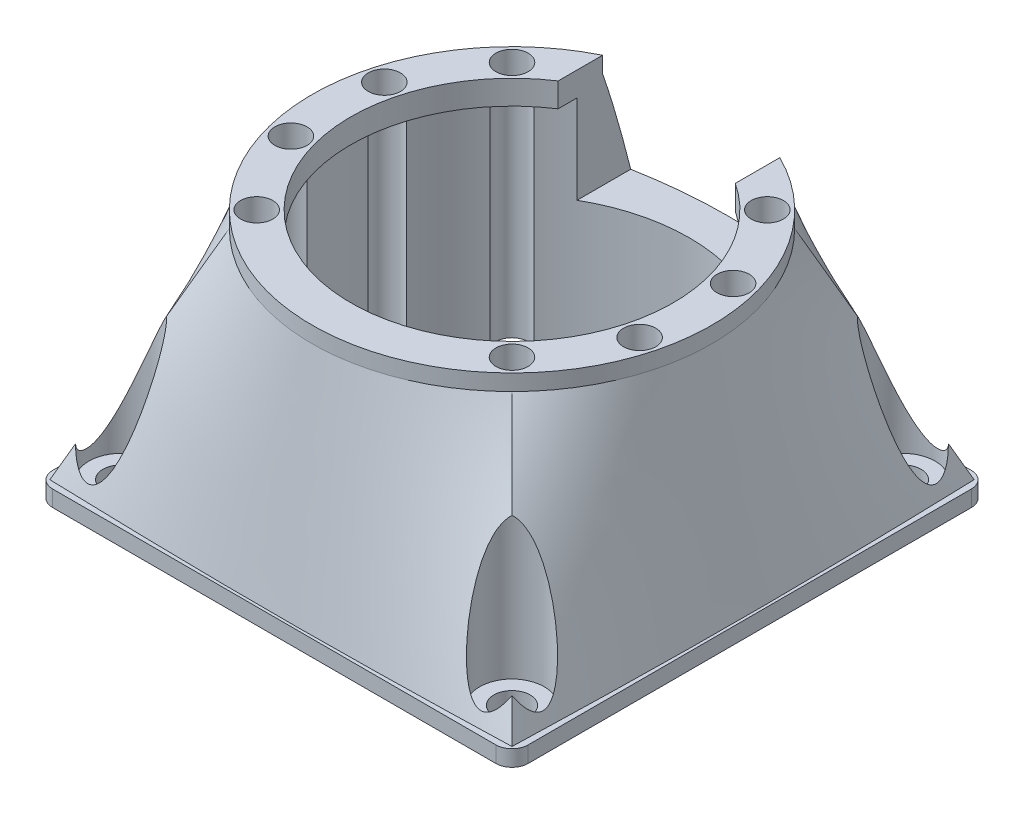
from build123d import *

# Parameters (mm, degrees)
SKETCH5_R               = 12.4
BOSS_EXTRUDE1_DEPTH     = 1
CUT_EXTRUDE1_DEPTH      = 26.987978163
CUT_EXTRUDE1_DEPTH_BACK = 26.987978163
SKETCH6_R               = 10
CUT_EXTRUDE2_DEPTH      = 26.987978163
CUT_EXTRUDE2_DEPTH_BACK = 23.5
SKETCH8_R               = 1
SKETCH1_W               = 29.5
SKETCH1_H               = 29.5
BOSS_EXTRUDE3_DEPTH     = 1
CUT_EXTRUDE4_DEPTH      = 14
CUT_EXTRUDE4_DEPTH_BACK = 8
SKETCH11_R              = 1.125
SKETCH11_R_2            = 11
CUT_EXTRUDE5_DEPTH      = 26.404232104
CUT_EXTRUDE5_DEPTH_BACK = 26.404232104
SKETCH12_R              = 1
SKETCH13_R              = 2
CUT_EXTRUDE6_DEPTH      = 26.404232104
SKETCH15_W              = 11
SKETCH15_H              = 7
CUT_EXTRUDE7_DEPTH      = 26.987978163
FILLET1_R               = 1


with BuildPart() as part:
    # Sketch2 for Loft3 → Loft3 section 0
    with BuildSketch(Plane(origin=(0, 14.5, 0), x_dir=(1, 0, 0), z_dir=(0, 1, 0))):
        with BuildLine():
            # circular arc as an exact rational Bezier (weights 1, cos(half-angle), 1)
            Bezier((8.768124087, -8.768124087), (0, -17.536248173), (-8.768124087, -8.768124087), weights=[1, 0.707106781, 1])
            Bezier((-8.768124087, -8.768124087), (-17.536248173, 0), (-8.768124087, 8.768124087), weights=[1, 0.707106781, 1])
            Bezier((-8.768124087, 8.768124087), (0, 17.536248173), (8.768124087, 8.768124087), weights=[1, 0.707106781, 1])
            Bezier((8.768124087, 8.768124087), (17.536248173, 0), (8.768124087, -8.768124087), weights=[1, 0.707106781, 1])
        make_face()
    # Sketch3 → Loft3 section 1
    with BuildSketch(Plane(origin=(0, 0, 0), x_dir=(1, 0, 0), z_dir=(0, 1, 0))):
        with BuildLine():
            Line((14.75, -14.75), (-14.75, -14.75))
            Line((-14.75, -14.75), (-14.75, 14.75))
            Line((-14.75, 14.75), (14.75, 14.75))
            Line((14.75, 14.75), (14.75, -14.75))
        make_face()
    loft()

    # Sketch5 → Boss-Extrude1 (add)
    with BuildSketch(Plane(origin=(0, 14.5, 0), x_dir=(1, 0, 0), z_dir=(0, 1, 0))):
        Circle(SKETCH5_R)
    extrude(amount=BOSS_EXTRUDE1_DEPTH)

    # Sketch6 → Cut-Extrude1 (cut, two sides: drawn at the far end of the back side and taken through both)
    with BuildSketch(Plane(origin=(0, 15.5, 0), x_dir=(1, 0, 0), z_dir=(0, 1, 0)).offset(-CUT_EXTRUDE1_DEPTH_BACK)):
        Circle(SKETCH6_R)
    extrude(amount=CUT_EXTRUDE1_DEPTH + CUT_EXTRUDE1_DEPTH_BACK, mode=Mode.SUBTRACT)

    # Sketch8 → Cut-Extrude2 (cut, two sides: drawn at the far end of the back side and taken through both)
    with BuildSketch(Plane(origin=(0, 15.5, 0), x_dir=(1, 0, 0), z_dir=(0, 1, 0)).offset(-CUT_EXTRUDE2_DEPTH_BACK)):
        with Locations((-7.919595949, 7.919595949)):
            Circle(SKETCH8_R)
        with Locations((-10.818369254, 2.898773305)):
            Circle(SKETCH8_R)
        with Locations((-10.818369254, -2.898773305)):
            Circle(SKETCH8_R)
        with Locations((-7.919595949, -7.919595949)):
            Circle(SKETCH8_R)
        with Locations((7.919595949, -7.919595949)):
            Circle(SKETCH8_R)
        with Locations((10.818369254, -2.898773305)):
            Circle(SKETCH8_R)
        with Locations((10.818369254, 2.898773305)):
            Circle(SKETCH8_R)
        with Locations((7.919595949, 7.919595949)):
            Circle(SKETCH8_R)
    extrude(amount=CUT_EXTRUDE2_DEPTH + CUT_EXTRUDE2_DEPTH_BACK, mode=Mode.SUBTRACT)

    # Sketch1 → Boss-Extrude3 (add)
    with BuildSketch(Plane(origin=(0, 0, 0), x_dir=(1, 0, 0), z_dir=(0, 1, 0))):
        Rectangle(SKETCH1_W, SKETCH1_H)
    extrude(amount=BOSS_EXTRUDE3_DEPTH)

    # Sketch11 → Cut-Extrude4 (cut, two sides: drawn at the far end of the back side and taken through both)
    with BuildSketch(Plane(origin=(0, 0, 0), x_dir=(1, 0, 0), z_dir=(0, 1, 0)).offset(-CUT_EXTRUDE4_DEPTH_BACK)):
        with Locations((-12.125, 12.125)):
            Circle(SKETCH11_R)
        with Locations((-12.125, -12.125)):
            Circle(SKETCH11_R)
        with Locations((12.125, -12.125)):
            Circle(SKETCH11_R)
        with Locations((12.125, 12.125)):
            Circle(SKETCH11_R)
        Circle(SKETCH11_R_2)
    extrude(amount=CUT_EXTRUDE4_DEPTH + CUT_EXTRUDE4_DEPTH_BACK, mode=Mode.SUBTRACT)

    # Sketch12 → Cut-Extrude5 (cut, two sides: drawn at the far end of the back side and taken through both)
    with BuildSketch(Plane(origin=(0, 1, 0), x_dir=(1, 0, 0), z_dir=(0, 1, 0)).offset(-CUT_EXTRUDE5_DEPTH_BACK)):
        with Locations((-7.919595949, 7.919595949)):
            Circle(SKETCH12_R)
        with Locations((-10.818369254, 2.898773305)):
            Circle(SKETCH12_R)
        with Locations((-10.818369254, -2.898773305)):
            Circle(SKETCH12_R)
        with Locations((-7.919595949, -7.919595949)):
            Circle(SKETCH12_R)
        with Locations((7.919595949, -7.919595949)):
            Circle(SKETCH12_R)
        with Locations((10.818369254, -2.898773305)):
            Circle(SKETCH12_R)
        with Locations((10.818369254, 2.898773305)):
            Circle(SKETCH12_R)
        with Locations((7.919595949, 7.919595949)):
            Circle(SKETCH12_R)
    extrude(amount=CUT_EXTRUDE5_DEPTH + CUT_EXTRUDE5_DEPTH_BACK, mode=Mode.SUBTRACT)

    # Sketch13 → Cut-Extrude6 (cut, through all)
    with BuildSketch(Plane(origin=(0, 1, 0), x_dir=(1, 0, 0), z_dir=(0, 1, 0))):
        with Locations((-12.125, 12.125)):
            Circle(SKETCH13_R)
        with Locations((12.125, 12.125)):
            Circle(SKETCH13_R)
        with Locations((12.125, -12.125)):
            Circle(SKETCH13_R)
        with Locations((-12.125, -12.125)):
            Circle(SKETCH13_R)
    extrude(amount=CUT_EXTRUDE6_DEPTH, mode=Mode.SUBTRACT)

    # Sketch15 → Cut-Extrude7 (cut, through all)
    with BuildSketch(Plane.XY):
        with Locations((0.004845478, 12)):
            Rectangle(SKETCH15_W, SKETCH15_H)
    extrude(amount=-CUT_EXTRUDE7_DEPTH, mode=Mode.SUBTRACT)

    # Fillet1
    fillet1_edges = [part.edges().sort_by_distance(p)[0] for p in [
        (-14.75, 0.5, -14.75),
        (14.75, 0.5, -14.75),
        (14.75, 0.5, 14.75),
        (-14.75, 0.5, 14.75),
    ]]
    fillet(fillet1_edges, radius=FILLET1_R)


solid = part.part
